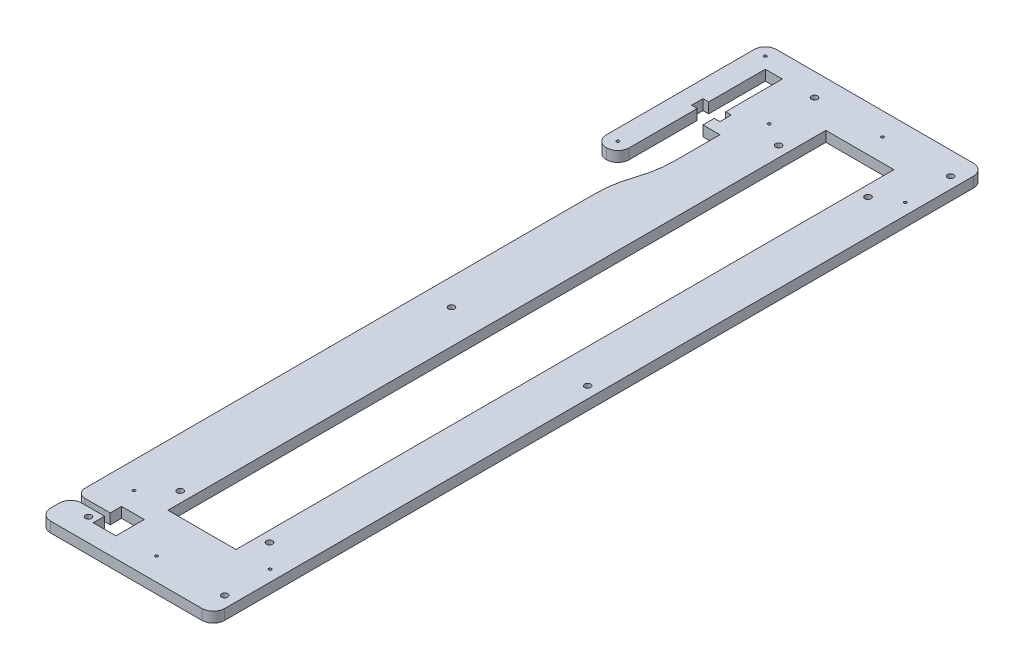
from build123d import *

# Parameters (mm, degrees)
SKETCH1_W            = 88.9
SKETCH1_H            = 431.8
BOSS_EXTRUDE1_DEPTH  = 5.8
M3_CLEARANCE_HOLE1_D = 3.4
SKETCH2_W            = 38.1
SKETCH2_H            = 368.3
CUT_EXTRUDE1_DEPTH   = 441.89464728
SKETCH3_W            = 8.5
SKETCH3_H            = 431.8
BOSS_EXTRUDE2_DEPTH  = 5.8
SKETCH7_R            = 0.79375
CUT_EXTRUDE2_DEPTH   = 443.68684191
SKETCH9_W            = 25.4
SKETCH9_H            = 95.25
BOSS_EXTRUDE3_DEPTH  = 5.8
CUT_EXTRUDE3_DEPTH   = 449.959597291
SKETCH10_R           = 0.79375
CUT_EXTRUDE4_DEPTH   = 449.959597291
CUT_EXTRUDE5_DEPTH   = 449.959597291
FILLET1_R            = 5
FILLET2_R            = 6.35
SKETCH12_R           = 1.7272
CUT_EXTRUDE6_DEPTH   = 449.959597291


with BuildPart() as part:
    # Sketch1 → Boss-Extrude1 (new body)
    with BuildSketch(Plane(origin=(0, 0, 0), x_dir=(1, 0, 0), z_dir=(0, 1, 0))):
        with Locations((-44.45, -215.9)):
            Rectangle(SKETCH1_W, SKETCH1_H)
    extrude(amount=BOSS_EXTRUDE1_DEPTH)

    # M3 Clearance Hole1 (through all)
    with Locations(Plane(origin=(0, 5.8, 0), x_dir=(-1, 0, 0), z_dir=(0, 1, 0))):
        with Locations((82.55, 12.7), (6.35, 12.7), (6.35, 419.1), (82.55, 419.1), (82.55, 215.9), (6.35, 215.9)):
            Hole(M3_CLEARANCE_HOLE1_D / 2)

    # Sketch2 → Cut-Extrude1 (cut, through all)
    with BuildSketch(Plane(origin=(0, 5.8, 0), x_dir=(1, 0, 0), z_dir=(0, 1, 0))):
        with Locations((-44.45, -209.55)):
            Rectangle(SKETCH2_W, SKETCH2_H)
    extrude(amount=-CUT_EXTRUDE1_DEPTH, mode=Mode.SUBTRACT)

    # Sketch3 → Boss-Extrude2 (add, through all)
    with BuildSketch(Plane(origin=(0, 5.8, 0), x_dir=(-1, 0, 0), z_dir=(0, 1, 0))):
        with Locations((93.15, 215.9)):
            Rectangle(SKETCH3_W, SKETCH3_H)
    extrude(amount=-BOSS_EXTRUDE2_DEPTH)

    # Sketch7 → Cut-Extrude2 (cut, through all)
    with BuildSketch(Plane(origin=(0, 5.8, 0), x_dir=(1, 0, 0), z_dir=(0, 1, 0))):
        with Locations(Location((-44.45, -12.7, 0), (0, 0, 270))):
            Circle(SKETCH7_R)
        with Locations(Location((-82.55, -38.1, 0), (0, 0, 270))):
            Circle(SKETCH7_R)
        with Locations(Location((-6.35, -38.1, 0), (0, 0, 270))):
            Circle(SKETCH7_R)
        with Locations(Location((-6.35, -393.7, 0), (0, 0, 90))):
            Circle(SKETCH7_R)
        with Locations(Location((-82.55, -393.7, 0), (0, 0, 90))):
            Circle(SKETCH7_R)
        with Locations(Location((-44.45, -419.1, 0), (0, 0, 90))):
            Circle(SKETCH7_R)
    extrude(amount=-CUT_EXTRUDE2_DEPTH, mode=Mode.SUBTRACT)

    # Sketch9 → Boss-Extrude3 (add, through all)
    with BuildSketch(Plane(origin=(0, 5.8, 0), x_dir=(1, 0, 0), z_dir=(0, 1, 0))):
        with Locations((-110.1, -47.625)):
            Rectangle(SKETCH9_W, SKETCH9_H)
    extrude(amount=-BOSS_EXTRUDE3_DEPTH)

    # Sketch8 → Cut-Extrude3 (cut, through all)
    with BuildSketch(Plane(origin=(0, 5.8, 0), x_dir=(1, 0, 0), z_dir=(0, 1, 0))):
        with BuildLine():
            Line((-110.1, -44.45), (-113.275, -44.45))
            Line((-113.275, -44.45), (-113.275, -50.8))
            Line((-113.275, -50.8), (-110.1, -50.8))
            Line((-110.1, -50.8), (-110.1, -95.25))
            Line((-110.1, -95.25), (-97.4, -95.25))
            Line((-97.4, -95.25), (-97.4, -120.65))
            ThreePointArc((-97.4, -120.65), (-96.600813101, -110.993614483), (-94.225, -101.6))
            ThreePointArc((-94.225, -101.6), (-91.849186899, -92.206385517), (-91.05, -82.55))
            Line((-91.05, -82.55), (-91.05, -57.15))
            Line((-91.05, -57.15), (-100.575, -57.15))
            Line((-100.575, -57.15), (-100.575, -50.8))
            Line((-100.575, -50.8), (-97.4, -50.8))
            Line((-97.4, -50.8), (-97.4, -44.45))
            Line((-97.4, -44.45), (-100.575, -44.45))
            Line((-100.575, -44.45), (-100.575, -12.7))
            Line((-100.575, -12.7), (-110.1, -12.7))
            Line((-110.1, -12.7), (-110.1, -44.45))
        make_face()
    extrude(amount=-CUT_EXTRUDE3_DEPTH, mode=Mode.SUBTRACT)

    # Sketch10 → Cut-Extrude4 (cut, through all)
    with BuildSketch(Plane(origin=(0, 5.8, 0), x_dir=(1, 0, 0), z_dir=(0, 1, 0))):
        with Locations(Location((-116.45, -88.9, 0), (0, 0, 270))):
            Circle(SKETCH10_R)
        with Locations(Location((-116.45, -6.35, 0), (0, 0, 270))):
            Circle(SKETCH10_R)
    extrude(amount=-CUT_EXTRUDE4_DEPTH, mode=Mode.SUBTRACT)

    # Sketch11 → Cut-Extrude5 (cut, through all)
    with BuildSketch(Plane(origin=(0, 5.8, 0), x_dir=(1, 0, 0), z_dir=(0, 1, 0))):
        Polygon((-97.4, -414.3375), (-78.35, -414.3375), (-78.35, -420.6875), (-65.65, -420.6875), (-65.65, -404.8125), (-78.35, -404.8125), (-78.35, -411.1625), (-97.4, -411.1625), align=None)
    extrude(amount=-CUT_EXTRUDE5_DEPTH, mode=Mode.SUBTRACT)

    # Fillet1
    fillet1_edges = [part.edges().sort_by_distance(p)[0] for p in [
        (-97.4, 2.9, 411.1625),
    ]]
    fillet(fillet1_edges, radius=FILLET1_R)

    # Fillet2
    fillet2_edges = [part.edges().sort_by_distance(p)[0] for p in [
        (0, 2.9, 431.8),
        (-97.4, 2.9, 414.3375),
        (-97.4, 2.9, 431.8),
        (-122.8, 2.9, 95.25),
        (0, 2.9, 0),
        (-122.8, 2.9, 0),
        (-110.1, 2.9, 95.25),
    ]]
    fillet(fillet2_edges, radius=FILLET2_R - 0.0001)  # a hair under: the kernel refuses the full size

    # Sketch12 → Cut-Extrude6 (cut, through all)
    with BuildSketch(Plane.XZ):
        with Locations(Location((-69.45, 380.9, 0), (0, 0, 270))):
            Circle(SKETCH12_R)
        with Locations(Location((-19.45, 380.9, 0), (0, 0, 90))):
            Circle(SKETCH12_R)
        with Locations(Location((-69.45, 45.9, 0), (0, 0, 270))):
            Circle(SKETCH12_R)
        with Locations(Location((-19.45, 45.9, 0), (0, 0, 90))):
            Circle(SKETCH12_R)
    extrude(amount=-CUT_EXTRUDE6_DEPTH, mode=Mode.SUBTRACT)


solid = part.part
